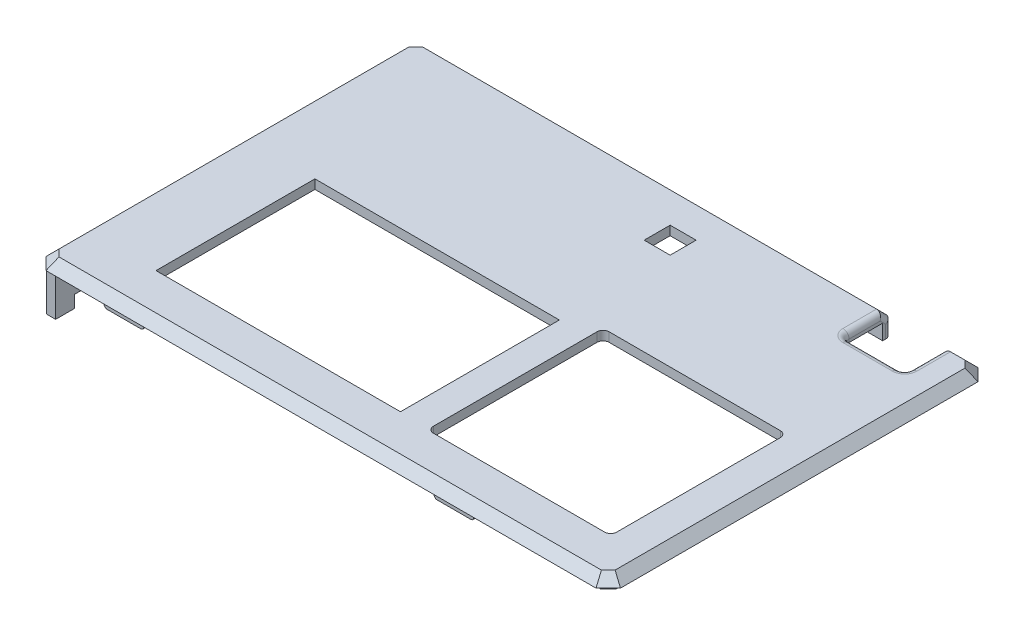
from build123d import *

# Parameters (mm, degrees)
EXTRUDE_1_DEPTH     = 3
SKETCH_2_W          = 13.000000000000007
SKETCH_2_H          = 2.000000000000014
SKETCH_2_W_2        = 12.999999999999993
EXTRUDE_2_DEPTH     = 4
CUT_EXTRUDE_1_REACH = 156.172
SKETCH_3_W          = 10.000000000000021
SKETCH_3_H          = 1.5
SKETCH_3_W_2        = 10
FILLET_1_R          = 1
CHAMFER_1_SIZE      = 4
CHAMFER_2_SIZE      = 3
EXTRUDE_3_DEPTH     = 1
CHAMFER_3_SIZE      = 2
CUT_EXTRUDE_2_REACH = 115.098
CUT_EXTRUDE_3_DEPTH = 1
EXTRUDE_4_DEPTH     = 16.4
CUT_EXTRUDE_4_REACH = 201.064
SKETCH_9_W          = 8.500000000000004
SKETCH_9_H          = 1.5000000000000036
SKETCH_10_W         = 14.5
SKETCH_10_H         = 1.5000000000000284
CUT_EXTRUDE_5_DEPTH = 1
SKETCH_11_W         = 14.496613720637008
SKETCH_11_H         = 3.000000000000007
EXTRUDE_5_DEPTH     = 5
FILLET_2_R          = 2


with BuildPart() as part:
    # 草图1 → 凸台-拉伸1 (new body)
    with BuildSketch(Plane(origin=(0, 0, 0), x_dir=(1, 0, 0), z_dir=(0, 1, 0))):
        Polygon((93.99999999999997, -62.499999999999964), (-94.00000000000001, -62.5), (-94.00000000000003, 62.500000000000014), (93.99999999999997, 62.50000000000004), align=None)
    extrude(amount=-EXTRUDE_1_DEPTH)

    # 草图2 → 凸台-拉伸2 (add)
    with BuildSketch(Plane.XZ.offset(3)):
        with Locations((-67.50000000000003, 58.5)):
            Rectangle(SKETCH_2_W, SKETCH_2_H)
        with Locations((40.49999999999994, 58.5)):
            Rectangle(SKETCH_2_W_2, SKETCH_2_H)
        with Locations((40.49999999999994, -58.5)):
            Rectangle(SKETCH_2_W_2, SKETCH_2_H)
        with Locations((-67.50000000000003, -58.5)):
            Rectangle(SKETCH_2_W, SKETCH_2_H)
    extrude(amount=EXTRUDE_2_DEPTH)

    # 切除-拉伸1: up to this face of the body (flat: up to its plane)
    cut_extrude_1_end = Plane(part.part.faces().sort_by_distance((40.5, -5, -59.5))[0])
    # 草图3 → 切除-拉伸1 (cut, up to the picked face)
    with BuildSketch(Plane.XY.offset(59.500000000000036), mode=Mode.PRIVATE) as cut_extrude_1_sk1:
        with Locations((-67.5, -4.75)):
            Rectangle(SKETCH_3_W, SKETCH_3_H)
    cut_extrude_1_tool1 = split(extrude(cut_extrude_1_sk1.sketch, amount=-CUT_EXTRUDE_1_REACH, mode=Mode.PRIVATE), bisect_by=cut_extrude_1_end, keep=Keep.BOTH, mode=Mode.PRIVATE)
    # 草图3 → 切除-拉伸1 (cut, up to the picked face)
    with BuildSketch(Plane.XY.offset(59.500000000000036), mode=Mode.PRIVATE) as cut_extrude_1_sk2:
        with Locations((40.499999999999986, -4.75)):
            Rectangle(SKETCH_3_W_2, SKETCH_3_H)
    cut_extrude_1_tool2 = split(extrude(cut_extrude_1_sk2.sketch, amount=-CUT_EXTRUDE_1_REACH, mode=Mode.PRIVATE), bisect_by=cut_extrude_1_end, keep=Keep.BOTH, mode=Mode.PRIVATE)
    add(cut_extrude_1_tool1.solids().sort_by(Axis((-67.5, -4.75, 59.5), (0, 0, -1)))[0], mode=Mode.SUBTRACT)
    add(cut_extrude_1_tool2.solids().sort_by(Axis((40.5, -4.75, 59.5), (0, 0, -1)))[0], mode=Mode.SUBTRACT)

    # 圆角1
    fillet_1_edges = [part.edges().sort_by_distance(p)[0] for p in [
        (-74.00000000000003, -7, 58.5),
        (-61.00000000000003, -7, 58.5),
        (33.99999999999995, -7, 58.5),
        (46.99999999999994, -7, 58.5),
        (33.99999999999995, -7, -58.5),
        (46.99999999999994, -7, -58.5),
        (-74.00000000000003, -7, -58.5),
        (-61.00000000000003, -7, -58.5),
    ]]
    fillet(fillet_1_edges, radius=FILLET_1_R)

    # 倒角1
    chamfer_1_edges = [part.edges().sort_by_distance(p)[0] for p in [
        (-94.00000000000003, -1.5, -62.500000000000014),
        (93.99999999999997, -1.5, -62.50000000000004),
        (93.99999999999997, -1.5, 62.499999999999964),
        (-94.00000000000001, -1.5, 62.5),
    ]]
    chamfer(chamfer_1_edges, length=CHAMFER_1_SIZE)

    # 倒角2
    chamfer_2_edges = [part.edges().sort_by_distance(p)[0] for p in [
        (91.99999999999997, 0, -60.50000000000005),
        (-2.842e-14, 0, -62.50000000000003),
        (-92.00000000000004, 0, -60.50000000000002),
        (-94.00000000000001, 0, -7.11e-15),
        (-92.00000000000003, 0, 60.5),
        (-2.842e-14, 0, 62.499999999999986),
        (91.99999999999999, 0, 60.499999999999964),
        (93.99999999999997, 0, -4.974e-14),
    ]]
    chamfer(chamfer_2_edges, length=CHAMFER_2_SIZE - 0.0001)  # a hair under: the kernel refuses the full size

    # 草图4 → 凸台-拉伸3 (add)
    with BuildSketch(Plane.XZ.offset(3)):
        Polygon((-89.99999999999997, -61.00000000000003), (-92.49999999999997, -58.50000000000002), (-92.49999999999999, 58.499999999999964), (-89.99999999999999, 60.999999999999964), (90.00000000000001, 60.99999999999999), (92.50000000000001, 58.49999999999999), (92.50000000000003, -58.5), (90.00000000000003, -61.00000000000001), align=None)
        Polygon((91, -59.49999999999999), (-91, -59.500000000000014), (-91, 59.49999999999998), (91, 59.50000000000001), align=None, mode=Mode.SUBTRACT)
    extrude(amount=EXTRUDE_3_DEPTH)

    # 倒角3
    chamfer_3_edges = [part.edges().sort_by_distance(p)[0] for p in [
        (91, -3.5, -59.49999999999999),
        (-91, -3.5, 59.49999999999998),
        (-91, -3.5, -59.500000000000014),
        (91, -3.5, 59.50000000000001),
    ]]
    chamfer(chamfer_3_edges, length=CHAMFER_3_SIZE)

    # 草图5 → 切除-拉伸2 (cut, up to next)
    with BuildSketch(Plane(origin=(0, 0, 0), x_dir=(1, 0, 0), z_dir=(0, 1, 0)), mode=Mode.PRIVATE) as cut_extrude_2_sk1:
        Polygon((-68.99999999999999, -47.49999999999995), (11.00000000000001, -47.49999999999995), (11.00000000000001, 4.500000000000045), (-68.99999999999999, 4.500000000000047), align=None)
    cut_extrude_2_tool1 = extrude(cut_extrude_2_sk1.sketch, amount=-CUT_EXTRUDE_2_REACH, mode=Mode.PRIVATE) & part.part
    # 草图5 → 切除-拉伸2 (cut, up to next)
    with BuildSketch(Plane(origin=(0, 0, 0), x_dir=(1, 0, 0), z_dir=(0, 1, 0)), mode=Mode.PRIVATE) as cut_extrude_2_sk2:
        Polygon((2.249999999999944, 40.99999999999997), (10.749999999999943, 40.99999999999997), (10.749999999999941, 49.49999999999997), (2.2499999999999423, 49.499999999999964), align=None)
    cut_extrude_2_tool2 = extrude(cut_extrude_2_sk2.sketch, amount=-CUT_EXTRUDE_2_REACH, mode=Mode.PRIVATE) & part.part
    # 草图5 → 切除-拉伸2 (cut, up to next)
    with BuildSketch(Plane(origin=(0, 0, 0), x_dir=(1, 0, 0), z_dir=(0, 1, 0)), mode=Mode.PRIVATE) as cut_extrude_2_sk3:
        with BuildLine():
            Line((61.79999999999998, 62.50000000000004), (81.99999999999997, 62.50000000000004))
            Line((81.99999999999997, 62.50000000000004), (81.99999999999997, 48.50000000000004))
            ThreePointArc((81.99999999999997, 48.50000000000004), (81.41421356237306, 47.08578643762695), (79.99999999999997, 46.50000000000004))
            Line((79.99999999999997, 46.50000000000004), (63.79999999999998, 46.50000000000004))
            ThreePointArc((63.79999999999998, 46.50000000000004), (62.38578643762689, 47.08578643762695), (61.79999999999998, 48.50000000000004))
            Line((61.79999999999998, 48.50000000000004), (61.79999999999998, 62.50000000000004))
        make_face()
    cut_extrude_2_tool3 = extrude(cut_extrude_2_sk3.sketch, amount=-CUT_EXTRUDE_2_REACH, mode=Mode.PRIVATE) & part.part
    # 草图5 → 切除-拉伸2 (cut, up to next)
    with BuildSketch(Plane(origin=(0, 0, 0), x_dir=(1, 0, 0), z_dir=(0, 1, 0)), mode=Mode.PRIVATE) as cut_extrude_2_sk4:
        with BuildLine():
            Line((22.500000000000018, 9.300000000000042), (78.49999999999999, 9.300000000000042))
            ThreePointArc((78.49999999999999, 9.300000000000042), (79.91421356237309, 8.714213562373137), (80.5, 7.300000000000027))
            Line((80.5, 7.300000000000027), (80.50000000000001, -46.199999999999946))
            ThreePointArc((80.50000000000001, -46.199999999999946), (79.9142135623731, -47.61421356237305), (78.5, -48.19999999999996))
            Line((78.5, -48.19999999999996), (22.500000000000025, -48.19999999999996))
            ThreePointArc((22.500000000000025, -48.19999999999996), (21.085786437626915, -47.61421356237305), (20.500000000000007, -46.199999999999946))
            Line((20.500000000000007, -46.199999999999946), (20.5, 7.300000000000027))
            ThreePointArc((20.5, 7.300000000000027), (21.085786437626904, 8.714213562373137), (22.500000000000018, 9.300000000000042))
        make_face()
    cut_extrude_2_tool4 = extrude(cut_extrude_2_sk4.sketch, amount=-CUT_EXTRUDE_2_REACH, mode=Mode.PRIVATE) & part.part
    add(cut_extrude_2_tool1.solids().sort_by_distance((-29, 0, 21.5))[0], mode=Mode.SUBTRACT)
    add(cut_extrude_2_tool2.solids().sort_by_distance((6.5, 0, -45.25))[0], mode=Mode.SUBTRACT)
    add(cut_extrude_2_tool3.solids().sort_by_distance((71.9, 0, -54.540337))[0], mode=Mode.SUBTRACT)
    add(cut_extrude_2_tool4.solids().sort_by_distance((50.5, 0, 19.45))[0], mode=Mode.SUBTRACT)

    # 草图7 → 切除-拉伸3 (cut)
    with BuildSketch(Plane.XZ.offset(4)):
        Polygon((-92.49999999999999, 58.499999999999964), (-89.99999999999994, 58.499999999999964), (-91, 57.49999999999998), (-91, -57.49999999999998), (-89.99999999999996, -58.50000000000002), (-92.49999999999997, -58.50000000000002), align=None)
    extrude(amount=-CUT_EXTRUDE_3_DEPTH, mode=Mode.SUBTRACT)

    # 草图8 → 凸台-拉伸4 (add)
    with BuildSketch(Plane.XZ.offset(3)):
        Polygon((-94.00000000000003, 58.349999999999966), (-91.00000000000003, 58.349999999999966), (-91.00000000000001, -58.35000000000003), (-94.00000000000001, -58.35000000000003), align=None)
    extrude(amount=EXTRUDE_4_DEPTH)

    # 草图9 → 切除-拉伸4 (cut, up to next)
    with BuildSketch(Plane.ZY.offset(94.00000000000003), mode=Mode.PRIVATE) as cut_extrude_4_sk1:
        Polygon((-14.25000000000002, -19.4), (-4.250000000000012, -19.4), (-4.250000000000012, -10.399999999999999), (-14.250000000000012, -10.399999999999999), align=None)
    cut_extrude_4_tool1 = extrude(cut_extrude_4_sk1.sketch, amount=-CUT_EXTRUDE_4_REACH, mode=Mode.PRIVATE) & part.part
    # 草图9 → 切除-拉伸4 (cut, up to next)
    with BuildSketch(Plane.ZY.offset(94.00000000000003), mode=Mode.PRIVATE) as cut_extrude_4_sk2:
        Polygon((52.24999999999998, -19.4), (38.54999999999998, -19.4), (38.54999999999998, -15.399999999999999), (52.24999999999998, -15.399999999999997), align=None)
    cut_extrude_4_tool2 = extrude(cut_extrude_4_sk2.sketch, amount=-CUT_EXTRUDE_4_REACH, mode=Mode.PRIVATE) & part.part
    # 草图9 → 切除-拉伸4 (cut, up to next)
    with BuildSketch(Plane.ZY.offset(94.00000000000003), mode=Mode.PRIVATE) as cut_extrude_4_sk3:
        Polygon((0.19999999999998752, -19.4), (0.19999999999998752, -16.9), (5.199999999999988, -16.9), (5.1999999999999895, -19.4), align=None)
    cut_extrude_4_tool3 = extrude(cut_extrude_4_sk3.sketch, amount=-CUT_EXTRUDE_4_REACH, mode=Mode.PRIVATE) & part.part
    # 草图9 → 切除-拉伸4 (cut, up to next)
    with BuildSketch(Plane.ZY.offset(94.00000000000003), mode=Mode.PRIVATE) as cut_extrude_4_sk4:
        with Locations((32.24999999999998, -18.65)):
            Rectangle(SKETCH_9_W, SKETCH_9_H)
    cut_extrude_4_tool4 = extrude(cut_extrude_4_sk4.sketch, amount=-CUT_EXTRUDE_4_REACH, mode=Mode.PRIVATE) & part.part
    add(cut_extrude_4_tool1.solids().sort_by_distance((-94, -14.9, -9.25))[0], mode=Mode.SUBTRACT)
    add(cut_extrude_4_tool2.solids().sort_by_distance((-94, -17.4, 45.4))[0], mode=Mode.SUBTRACT)
    add(cut_extrude_4_tool3.solids().sort_by_distance((-94, -18.15, 2.7))[0], mode=Mode.SUBTRACT)
    add(cut_extrude_4_tool4.solids().sort_by_distance((-94, -18.65, 32.25))[0], mode=Mode.SUBTRACT)

    # 草图10 → 切除-拉伸5 (cut)
    with BuildSketch(Plane.XZ.offset(4)):
        with Locations((54.54999999999998, -60.25000000000001)):
            Rectangle(SKETCH_10_W, SKETCH_10_H)
    extrude(amount=-CUT_EXTRUDE_5_DEPTH, mode=Mode.SUBTRACT)

    # 草图11 → 凸台-拉伸5 (add)
    with BuildSketch(Plane.XZ.offset(3)):
        with Locations((54.551693139681475, -61.00000000000004)):
            Rectangle(SKETCH_11_W, SKETCH_11_H)
    extrude(amount=EXTRUDE_5_DEPTH)

    # 圆角2
    fillet_2_edges = [part.edges().sort_by_distance(p)[0] for p in [
        (81.99999999999997, 0, -54.000050000000044),
        (81.41421356237306, 0, -47.08578643762695),
        (71.89999999999998, 0, -46.50000000000004),
        (62.38578643762689, 0, -47.08578643762695),
        (81.99999999999997, -1.499950000000006, -61.00005000000004),
        (61.79999999999998, -5.49995, -62.50000000000004),
        (61.79999999999998, -1.4999500000000077, -61.00005000000003),
        (61.79999999999998, 0, -54.000050000000044),
    ]]
    fillet(fillet_2_edges, radius=FILLET_2_R)


solid = part.part
